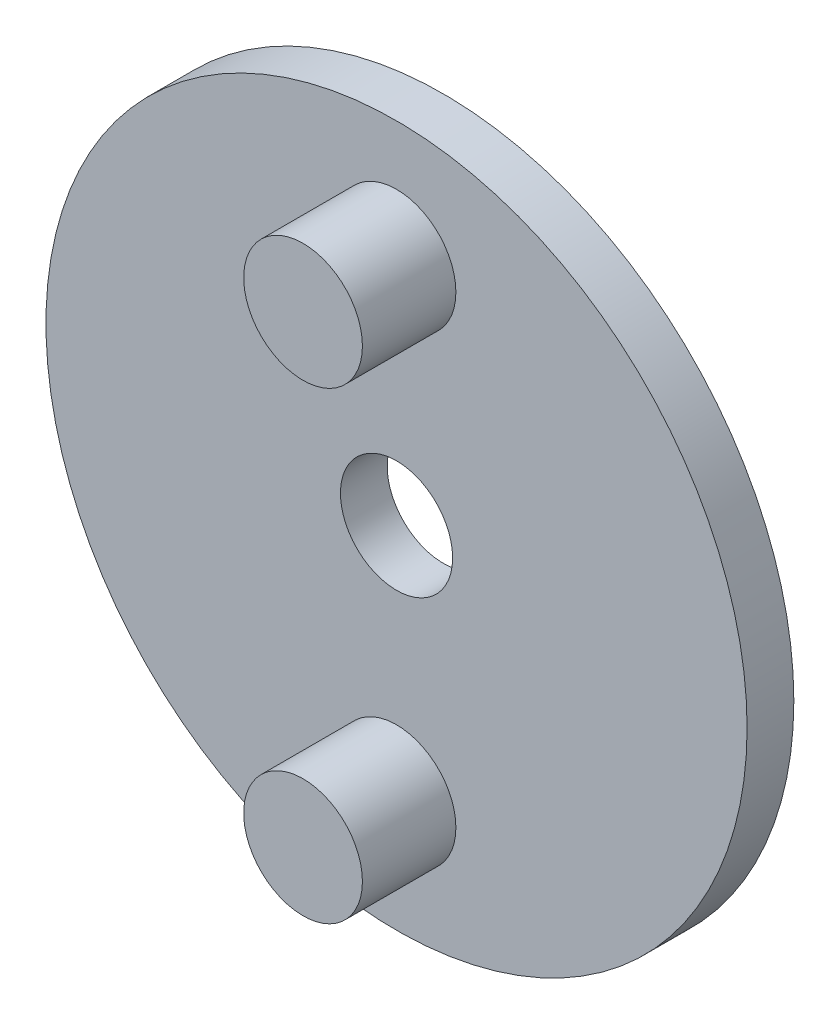
from build123d import *

# Parameters (mm, degrees)
SKETCH1_R           = 37.5
SKETCH1_R_2         = 6
SKETCH1_R_3         = 6.35
BOSS_EXTRUDE1_DEPTH = 5
SKETCH2_R           = 6.35
BOSS_EXTRUDE2_DEPTH = 15


with BuildPart() as part:
    # Sketch1 → Boss-Extrude1 (new body)
    with BuildSketch(Plane.XY):
        Circle(SKETCH1_R)
        Circle(SKETCH1_R_2, mode=Mode.SUBTRACT)
        with Locations((0, -24.8)):
            Circle(SKETCH1_R_3, mode=Mode.SUBTRACT)
        with Locations((0, 24.8)):
            Circle(SKETCH1_R_3, mode=Mode.SUBTRACT)
    extrude(amount=BOSS_EXTRUDE1_DEPTH)

    # Sketch2 → Boss-Extrude2 (add)
    with BuildSketch(Plane.XY):
        with Locations((0, -24.8)):
            Circle(SKETCH2_R)
        with Locations((0, 24.8)):
            Circle(SKETCH2_R)
    extrude(amount=BOSS_EXTRUDE2_DEPTH)


solid = part.part
